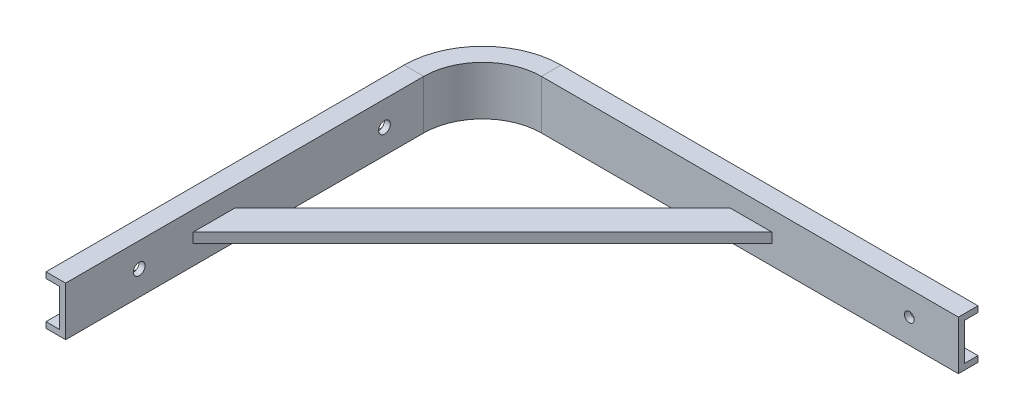
from build123d import *

# Parameters (mm, degrees)
ESQUISSE1_W                  = 450
ESQUISSE1_H                  = 25
EXTRUSION1_DEPTH             = 10
PLIAGE_START                 = -12.5
PLIAGE_1_DEPTH               = 25
PLIAGE_1_2_DEPTH             = 25
ESQUISSE5_R                  = 3
ENL_V_MAT_EXTRU_1_DEPTH      = 330.361564282
ESQUISSE7_R                  = 2.5
ENL_V_MAT_EXTRU_2_DEPTH      = 331.27116136
ENL_V_MAT_EXTRU_3_DEPTH      = 9.5
ENL_V_MAT_EXTRU_3_DEPTH_BACK = 9.5
EXTRUSION2_DEPTH             = 2.5


# Read off the part's stored shape, not the designer's step: Pliage 1
with BuildPart() as part:
    # Esquisse1 → Extrusion1 (new body)
    with BuildSketch(Plane.XY):
        with Locations((-225, 0)):
            Rectangle(ESQUISSE1_W, ESQUISSE1_H)
    extrude(amount=EXTRUSION1_DEPTH)

    # Pliage 1 outline → Pliage 1 (cut)
    with BuildSketch(Plane(origin=(0, 0, 0), x_dir=(1, 0, 0), z_dir=(0, 1, 0)).offset(PLIAGE_START)):
        with BuildLine():
            Line((-450, -10), (-238.968577392, -10))
            ThreePointArc((-238.968577392, -10), (-226.653199905, -2.583426132), (-212.511064281, 0))
            Line((-212.511064281, 0), (-450, 0))
            Line((-450, 0), (-450, -10))
        make_face()
    extrude(amount=PLIAGE_1_DEPTH, mode=Mode.SUBTRACT)

    # Pliage 1 2 outline → Pliage 1 2 (add)
    with BuildSketch(Plane(origin=(0, 0, 0), x_dir=(1, 0, 0), z_dir=(0, 1, 0)).offset(PLIAGE_START)):
        with BuildLine():
            ThreePointArc((-238.968577392, -10), (-248.968577392, -23.542486889), (-252.511064281, -40))
            Line((-252.511064281, -40), (-252.511064281, -222.511064281))
            Line((-252.511064281, -222.511064281), (-242.511064281, -222.511064281))
            Line((-242.511064281, -222.511064281), (-242.511064281, -40))
            ThreePointArc((-242.511064281, -40), (-233.724267717, -18.786796564), (-212.511064281, -10))
            Line((-212.511064281, -10), (-238.968577392, -10))
        make_face()
    extrude(amount=PLIAGE_1_2_DEPTH)

    # Esquisse5 → Enlèv. mat.-Extru.1 (cut, through all)
    with BuildSketch(Plane(origin=(-242.511064281, 0, 0), x_dir=(0, 0, -1), z_dir=(1, 0, 0))):
        with Locations((-185, 0)):
            Circle(ESQUISSE5_R)
        with Locations((-60, 0)):
            Circle(ESQUISSE5_R)
    extrude(amount=-ENL_V_MAT_EXTRU_1_DEPTH, mode=Mode.SUBTRACT)

    # Esquisse7 → Enlèv. mat.-Extru.2 (cut, through all)
    with BuildSketch(Plane.XY.offset(10)):
        with Locations((-25, 0)):
            Circle(ESQUISSE7_R)
    extrude(amount=-ENL_V_MAT_EXTRU_2_DEPTH, mode=Mode.SUBTRACT)

    # Esquisse8 → Enlèv. mat.-Extru.3 (cut, two sides: drawn at the far end of the back side and taken through both)
    with BuildSketch(Plane(origin=(0, 0, 0), x_dir=(1, 0, 0), z_dir=(0, 1, 0)).offset(-ENL_V_MAT_EXTRU_3_DEPTH_BACK)):
        with BuildLine():
            Line((0, -7), (-212.511064281, -7))
            ThreePointArc((-212.511064281, -7), (-235.84558806, -16.665476221), (-245.511064281, -40))
            Line((-245.511064281, -40), (-245.511064281, -222.511064281))
            Line((-245.511064281, -222.511064281), (-252.511064281, -222.511064281))
            Line((-252.511064281, -222.511064281), (-252.511064281, -40))
            ThreePointArc((-252.511064281, -40), (-240.795335529, -11.715728753), (-212.511064281, 0))
            Line((-212.511064281, 0), (0, 0))
            Line((0, 0), (0, -7))
        make_face()
    extrude(amount=ENL_V_MAT_EXTRU_3_DEPTH + ENL_V_MAT_EXTRU_3_DEPTH_BACK, mode=Mode.SUBTRACT)

    # Esquisse6 → Extrusion2 (add, symmetric)
    with BuildSketch(Plane(origin=(0, 0, 0), x_dir=(1, 0, 0), z_dir=(0, 1, 0))):
        Polygon((-242.511064281, -136.297860845), (-116.213203436, -10), (-95, -10), (-242.511064281, -157.511064281), align=None)
    extrude(amount=EXTRUSION2_DEPTH, both=True)


solid = part.part
